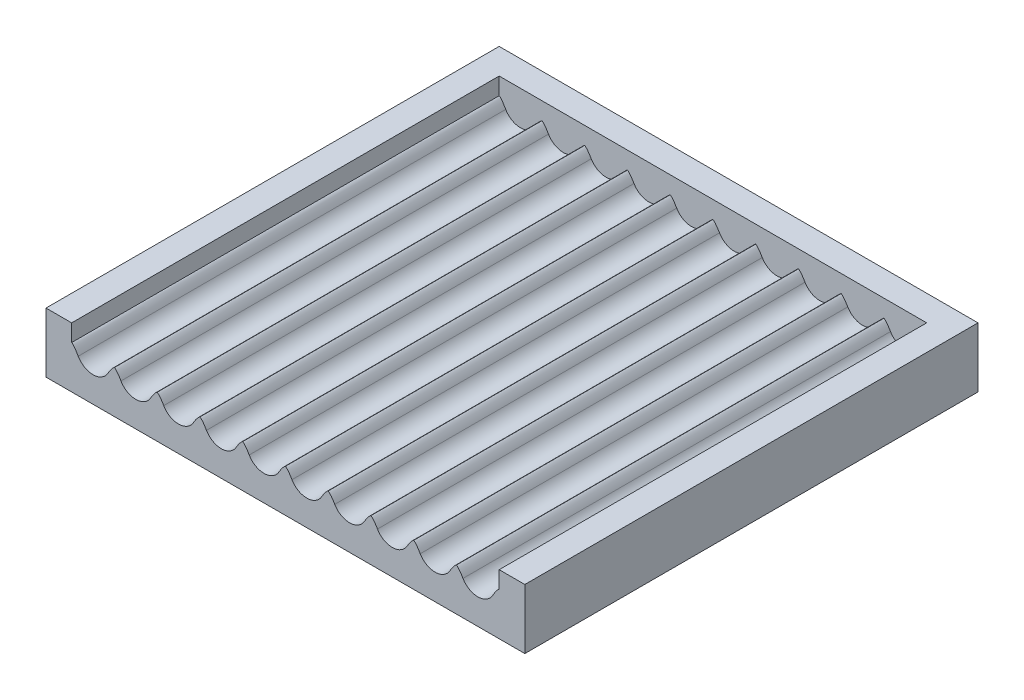
from build123d import *

# Parameters (mm, degrees)
SKETCH1_W           = 100
SKETCH1_H           = 100
BOSS_EXTRUDE1_DEPTH = 10
SKETCH2_W           = 100
SKETCH2_H           = 14
BOSS_EXTRUDE2_DEPTH = 6
SKETCH3_R           = 4
CUT_EXTRUDE1_DEPTH  = 100
FILLET1_DEPTH       = 101
SKETCH4_W           = 106
SKETCH4_H           = 14
BOSS_EXTRUDE3_DEPTH = 6
SKETCH5_W           = 106
SKETCH5_H           = 14
BOSS_EXTRUDE4_DEPTH = 6


with BuildPart() as part:
    # Sketch1 → Boss-Extrude1 (new body)
    with BuildSketch(Plane(origin=(0, 0, 0), x_dir=(1, 0, 0), z_dir=(0, 1, 0))):
        with Locations((50, -50)):
            Rectangle(SKETCH1_W, SKETCH1_H)
    extrude(amount=BOSS_EXTRUDE1_DEPTH)

    # Sketch2 → Boss-Extrude2 (add)
    with BuildSketch(Plane(origin=(0, 0, 0), x_dir=(-1, 0, 0), z_dir=(0, 0, -1))):
        with Locations((-50, 7)):
            Rectangle(SKETCH2_W, SKETCH2_H)
    extrude(amount=BOSS_EXTRUDE2_DEPTH)

    # Sketch3 → Cut-Extrude1 (cut)
    with BuildSketch(Plane.XY.offset(100)):
        with Locations((5, 10)):
            Circle(SKETCH3_R)
        with Locations((15, 10)):
            Circle(SKETCH3_R)
        with Locations((25, 10)):
            Circle(SKETCH3_R)
        with Locations((35, 10)):
            Circle(SKETCH3_R)
        with Locations((45, 10)):
            Circle(SKETCH3_R)
        with Locations((55, 10)):
            Circle(SKETCH3_R)
        with Locations((65, 10)):
            Circle(SKETCH3_R)
        with Locations((75, 10)):
            Circle(SKETCH3_R)
        with Locations((85, 10)):
            Circle(SKETCH3_R)
        with Locations((95, 10)):
            Circle(SKETCH3_R)
    extrude(amount=-CUT_EXTRUDE1_DEPTH, mode=Mode.SUBTRACT)

    # Fillet1: read off the stored shape, not the designer's step
    # Fillet1 outline → Fillet1 (cut)
    with BuildSketch(Plane.XY):
        with BuildLine():
            add(Edge.make_bspline(
                [(1.533333333, 8.004449394), (0.4, 9.973273876), (0, 10)],
                knots=[0, 0, 0, 1, 1, 1], degree=2, weights=[1, 0.881917104, 1]))
            ThreePointArc((1.533333333, 8.004449394), (1.135632868, 8.967204441), (1, 10))
            Line((1, 10), (0, 10))
        make_face()
        with BuildLine():
            add(Edge.make_bspline(
                [(11.535898385, 8), (10.599666447, 9.621601285), (9.99999988, 9.941275628)],
                knots=[0, 0, 0, 0.831887243, 0.831887243, 0.831887243], degree=2, weights=[1, 0.888548242, 0.962527076]))
            ThreePointArc((11.535898385, 8), (11.136296695, 8.96472382), (11, 10))
            Line((11, 10), (9, 10))
            ThreePointArc((9, 10), (8.863703305, 8.96472382), (8.464101615, 8))
            add(Edge.make_bspline(
                [(9.99999988, 9.941275628), (9.400396177, 9.621709752), (8.464101615, 8)],
                knots=[0.168063315, 0.168063315, 0.168063315, 1, 1, 1], degree=2, weights=[0.96253587, 0.888541618, 1]))
        make_face()
        with BuildLine():
            add(Edge.make_bspline(
                [(21.535898385, 8), (20.599666447, 9.621601285), (19.99999988, 9.941275628)],
                knots=[0, 0, 0, 0.831887243, 0.831887243, 0.831887243], degree=2, weights=[1, 0.888548242, 0.962527076]))
            ThreePointArc((21.535898385, 8), (21.136296695, 8.96472382), (21, 10))
            Line((21, 10), (19, 10))
            ThreePointArc((19, 10), (18.863703305, 8.96472382), (18.464101615, 8))
            add(Edge.make_bspline(
                [(19.99999988, 9.941275628), (19.400396177, 9.621709752), (18.464101615, 8)],
                knots=[0.168063315, 0.168063315, 0.168063315, 1, 1, 1], degree=2, weights=[0.96253587, 0.888541618, 1]))
        make_face()
        with BuildLine():
            add(Edge.make_bspline(
                [(31.535898385, 8), (30.599666447, 9.621601285), (29.99999988, 9.941275628)],
                knots=[0, 0, 0, 0.831887243, 0.831887243, 0.831887243], degree=2, weights=[1, 0.888548242, 0.962527076]))
            ThreePointArc((31.535898385, 8), (31.136296695, 8.96472382), (31, 10))
            Line((31, 10), (29, 10))
            ThreePointArc((29, 10), (28.863703305, 8.96472382), (28.464101615, 8))
            add(Edge.make_bspline(
                [(29.99999988, 9.941275628), (29.400396177, 9.621709752), (28.464101615, 8)],
                knots=[0.168063315, 0.168063315, 0.168063315, 1, 1, 1], degree=2, weights=[0.96253587, 0.888541618, 1]))
        make_face()
        with BuildLine():
            add(Edge.make_bspline(
                [(41.535898385, 8), (40.599666447, 9.621601285), (39.99999988, 9.941275628)],
                knots=[0, 0, 0, 0.831887243, 0.831887243, 0.831887243], degree=2, weights=[1, 0.888548242, 0.962527076]))
            ThreePointArc((41.535898385, 8), (41.136296695, 8.96472382), (41, 10))
            Line((41, 10), (39, 10))
            ThreePointArc((39, 10), (38.863703305, 8.96472382), (38.464101615, 8))
            add(Edge.make_bspline(
                [(39.99999988, 9.941275628), (39.400396177, 9.621709752), (38.464101615, 8)],
                knots=[0.168063315, 0.168063315, 0.168063315, 1, 1, 1], degree=2, weights=[0.96253587, 0.888541618, 1]))
        make_face()
        with BuildLine():
            add(Edge.make_bspline(
                [(51.535898385, 8), (50.599666447, 9.621601285), (49.99999988, 9.941275628)],
                knots=[0, 0, 0, 0.831887243, 0.831887243, 0.831887243], degree=2, weights=[1, 0.888548242, 0.962527076]))
            ThreePointArc((51.535898385, 8), (51.136296695, 8.96472382), (51, 10))
            Line((51, 10), (49, 10))
            ThreePointArc((49, 10), (48.863703305, 8.96472382), (48.464101615, 8))
            add(Edge.make_bspline(
                [(49.99999988, 9.941275628), (49.400396177, 9.621709752), (48.464101615, 8)],
                knots=[0.168063315, 0.168063315, 0.168063315, 1, 1, 1], degree=2, weights=[0.96253587, 0.888541618, 1]))
        make_face()
        with BuildLine():
            add(Edge.make_bspline(
                [(61.535898385, 8), (60.599666447, 9.621601285), (59.99999988, 9.941275628)],
                knots=[0, 0, 0, 0.831887243, 0.831887243, 0.831887243], degree=2, weights=[1, 0.888548242, 0.962527076]))
            ThreePointArc((61.535898385, 8), (61.136296695, 8.96472382), (61, 10))
            Line((61, 10), (59, 10))
            ThreePointArc((59, 10), (58.863703305, 8.96472382), (58.464101615, 8))
            add(Edge.make_bspline(
                [(59.99999988, 9.941275628), (59.400396177, 9.621709752), (58.464101615, 8)],
                knots=[0.168063315, 0.168063315, 0.168063315, 1, 1, 1], degree=2, weights=[0.96253587, 0.888541618, 1]))
        make_face()
        with BuildLine():
            add(Edge.make_bspline(
                [(71.535898385, 8), (70.599666447, 9.621601285), (69.99999988, 9.941275628)],
                knots=[0, 0, 0, 0.831887243, 0.831887243, 0.831887243], degree=2, weights=[1, 0.888548242, 0.962527076]))
            ThreePointArc((71.535898385, 8), (71.136296695, 8.96472382), (71, 10))
            Line((71, 10), (69, 10))
            ThreePointArc((69, 10), (68.863703305, 8.96472382), (68.464101615, 8))
            add(Edge.make_bspline(
                [(69.99999988, 9.941275628), (69.400396177, 9.621709752), (68.464101615, 8)],
                knots=[0.168063315, 0.168063315, 0.168063315, 1, 1, 1], degree=2, weights=[0.96253587, 0.888541618, 1]))
        make_face()
        with BuildLine():
            add(Edge.make_bspline(
                [(81.535898385, 8), (80.599666447, 9.621601285), (79.99999988, 9.941275628)],
                knots=[0, 0, 0, 0.831887243, 0.831887243, 0.831887243], degree=2, weights=[1, 0.888548242, 0.962527076]))
            ThreePointArc((81.535898385, 8), (81.136296695, 8.96472382), (81, 10))
            Line((81, 10), (79, 10))
            ThreePointArc((79, 10), (78.863703305, 8.96472382), (78.464101615, 8))
            add(Edge.make_bspline(
                [(79.99999988, 9.941275628), (79.400396177, 9.621709752), (78.464101615, 8)],
                knots=[0.168063315, 0.168063315, 0.168063315, 1, 1, 1], degree=2, weights=[0.96253587, 0.888541618, 1]))
        make_face()
        with BuildLine():
            add(Edge.make_bspline(
                [(91.535898385, 8), (90.599666447, 9.621601285), (89.99999988, 9.941275628)],
                knots=[0, 0, 0, 0.831887243, 0.831887243, 0.831887243], degree=2, weights=[1, 0.888548242, 0.962527076]))
            ThreePointArc((91.535898385, 8), (91.136296695, 8.96472382), (91, 10))
            Line((91, 10), (89, 10))
            ThreePointArc((89, 10), (88.863703305, 8.96472382), (88.464101615, 8))
            add(Edge.make_bspline(
                [(89.99999988, 9.941275628), (89.400396177, 9.621709752), (88.464101615, 8)],
                knots=[0.168063315, 0.168063315, 0.168063315, 1, 1, 1], degree=2, weights=[0.96253587, 0.888541618, 1]))
        make_face()
        with BuildLine():
            add(Edge.make_bspline(
                [(100, 10), (99.6, 9.973273876), (98.466666667, 8.004449394)],
                knots=[0, 0, 0, 1, 1, 1], degree=2, weights=[1, 0.881917104, 1]))
            Line((100, 10), (99, 10))
            ThreePointArc((99, 10), (98.864367132, 8.967204441), (98.466666667, 8.004449394))
        make_face()
    extrude(amount=FILLET1_DEPTH, mode=Mode.SUBTRACT)

    # Sketch4 → Boss-Extrude3 (add)
    with BuildSketch(Plane.ZY):
        with Locations((47, 7)):
            Rectangle(SKETCH4_W, SKETCH4_H)
    extrude(amount=BOSS_EXTRUDE3_DEPTH)

    # Sketch5 → Boss-Extrude4 (add)
    with BuildSketch(Plane(origin=(100, 0, 0), x_dir=(0, 0, -1), z_dir=(1, 0, 0))):
        with Locations((-47, 7)):
            Rectangle(SKETCH5_W, SKETCH5_H)
    extrude(amount=BOSS_EXTRUDE4_DEPTH)


solid = part.part
